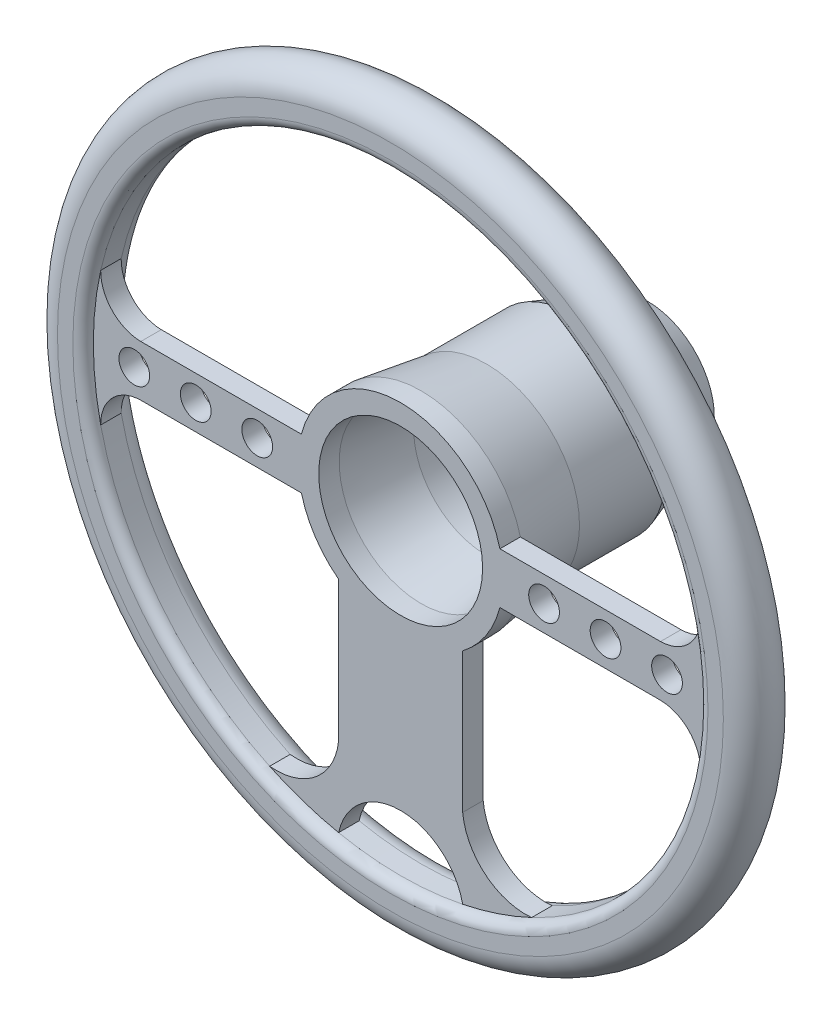
from build123d import *

# Parameters (mm, degrees)
SZKIC1_R                    = 175
SZKIC1_R_2                  = 40
SZKIC1_R_3                  = 7.5
DODANIE_WYCI_GNI_CIE1_DEPTH = 25
ZAOKR_GLENIE1_R             = 12.5
SZKIC2_W                    = 10
SZKIC2_H                    = 150
SZKIC3_W                    = 5
SZKIC3_H                    = 150
ZAOKR_GLENIE4_R             = 10
ZAOKR_GLENIE5_R             = 5
SZKIC5_R                    = 12
SZKIC5_R_2                  = 4
WYTNIJ_WYCI_GNI_CIE1_DEPTH  = 25
DODANIE_WYCI_GNI_CIE4_START = 45
SZKIC9_R                    = 27.052132897
SZKIC9_R_2                  = 12
SZKIC9_R_3                  = 4
DODANIE_WYCI_GNI_CIE4_DEPTH = 45


with BuildPart() as part:
    # Szkic1 → Dodanie-wyciągnięcie1 (new body)
    with BuildSketch(Plane.XY):
        Circle(SZKIC1_R)
        Circle(SZKIC1_R_2, mode=Mode.SUBTRACT)
        with BuildLine():
            ThreePointArc((63.948658552, -135.685552176), (41.3963046, -128.857575517), (30.277490786, -108.082544509))
            Line((30.277490786, -108.082544509), (30.277490786, -39.790370088))
            ThreePointArc((30.277490786, -39.790370088), (41.668308443, -27.636064689), (48.434312767, -12.414400782))
            Line((48.434312767, -12.414400782), (126.821344913, -12.414400782))
            ThreePointArc((126.821344913, -12.414400782), (140.806039181, -18.492039568), (146.397171731, -32.678251316))
            ThreePointArc((146.397171731, -32.678251316), (117.106652616, -93.733835476), (63.948658552, -135.685552176))
        make_face(mode=Mode.SUBTRACT)
        with BuildLine():
            ThreePointArc((146.397171731, 32.678251316), (140.806039181, 18.492039568), (126.821344913, 12.414400782))
            Line((126.821344913, 12.414400782), (48.434312767, 12.414400782))
            ThreePointArc((48.434312767, 12.414400782), (0, 50), (-48.434312767, 12.414400782))
            Line((-48.434312767, 12.414400782), (-126.821344913, 12.414400782))
            ThreePointArc((-126.821344913, 12.414400782), (-140.806039181, 18.492039568), (-146.397171731, 32.678251316))
            ThreePointArc((-146.397171731, 32.678251316), (0, 150), (146.397171731, 32.678251316))
        make_face(mode=Mode.SUBTRACT)
        with BuildLine():
            ThreePointArc((-146.397171731, -32.678251316), (-140.806039181, -18.492039568), (-126.821344913, -12.414400782))
            Line((-126.821344913, -12.414400782), (-48.434312767, -12.414400782))
            ThreePointArc((-48.434312767, -12.414400782), (-41.668308443, -27.636064689), (-30.277490786, -39.790370088))
            Line((-30.277490786, -39.790370088), (-30.277490786, -108.082544509))
            ThreePointArc((-30.277490786, -108.082544509), (-41.3963046, -128.857575517), (-63.948658552, -135.685552176))
            ThreePointArc((-63.948658552, -135.685552176), (-117.106652616, -93.733835476), (-146.397171731, -32.678251316))
        make_face(mode=Mode.SUBTRACT)
        with BuildLine():
            ThreePointArc((-30.277490786, -146.912469014), (0, -122.410388377), (30.277490786, -146.912469014))
            ThreePointArc((30.277490786, -146.912469014), (0, -150), (-30.277490786, -146.912469014))
        make_face(mode=Mode.SUBTRACT)
        with Locations((-70, 0)):
            Circle(SZKIC1_R_3, mode=Mode.SUBTRACT)
        with Locations((-100, 0)):
            Circle(SZKIC1_R_3, mode=Mode.SUBTRACT)
        with Locations((-130, 0)):
            Circle(SZKIC1_R_3, mode=Mode.SUBTRACT)
        with Locations((100, 0)):
            Circle(SZKIC1_R_3, mode=Mode.SUBTRACT)
        with Locations((70, 0)):
            Circle(SZKIC1_R_3, mode=Mode.SUBTRACT)
        with Locations((130, 0)):
            Circle(SZKIC1_R_3, mode=Mode.SUBTRACT)
    extrude(amount=DODANIE_WYCI_GNI_CIE1_DEPTH)

    # Zaokrąglenie1
    zaokr_glenie1_edges = [part.edges().sort_by_distance(p)[0] for p in [
        (-175, 0, 25),
        (-175, 0, 0),
    ]]
    fillet(zaokr_glenie1_edges, radius=ZAOKR_GLENIE1_R - 0.0001)  # a hair under: the kernel refuses the full size

    # Szkic2 → Wycięcie-obrót1 (revolve, cut)
    with BuildSketch(Plane(origin=(0, 0, 0), x_dir=(0, 0, -1), z_dir=(1, 0, 0)), mode=Mode.PRIVATE) as wyci_cie_obr_t1_sk:
        with Locations((-5, -75)):
            Rectangle(SZKIC2_W, SZKIC2_H)
    revolve(wyci_cie_obr_t1_sk.sketch.rotate(Axis((0, 0, 10), (0, 0, -1)), 77.416921492), axis=Axis((0, 0, 10), (0, 0, -1)), mode=Mode.SUBTRACT)

    # Szkic3 → Wycięcie-obrót2 (revolve, cut)
    with BuildSketch(Plane(origin=(0, 0, 0), x_dir=(0, 0, -1), z_dir=(1, 0, 0)), mode=Mode.PRIVATE) as wyci_cie_obr_t2_sk:
        with Locations((-22.5, -75)):
            Rectangle(SZKIC3_W, SZKIC3_H)
    revolve(wyci_cie_obr_t2_sk.sketch.rotate(Axis((0, 0, 20), (0, 0, 1)), 90), axis=Axis((0, 0, 20), (0, 0, 1)), mode=Mode.SUBTRACT)

    # Zaokrąglenie4
    zaokr_glenie4_edges = [part.edges().sort_by_distance(p)[0] for p in [
        (150, 0, 0),
    ]]
    fillet(zaokr_glenie4_edges, radius=ZAOKR_GLENIE4_R - 0.0001)  # a hair under: the kernel refuses the full size

    # Zaokrąglenie5
    zaokr_glenie5_edges = [part.edges().sort_by_distance(p)[0] for p in [
        (149.096572328, -16.438130069, 25),
    ]]
    fillet(zaokr_glenie5_edges, radius=ZAOKR_GLENIE5_R - 0.0001)  # a hair under: the kernel refuses the full size

    # Szkic4 → Obrót3 (revolve)
    with BuildSketch(Plane(origin=(0, 0, 0), x_dir=(0, 0, -1), z_dir=(1, 0, 0))):
        Polygon((-10, 50), (21.913455258, 45.379893009), (63.909884625, 45.379893009), (100.428518858, 32.678251316), (100.428518858, 0), (90.618518858, 0), (90.618518858, 27.052132897), (63.909884625, 35.565510059), (21.913455258, 35.565510059), (-10, 40), align=None)
    revolve(axis=Axis((0, 0, -90.618518858), (0, 0, 1)))

    # Szkic5 → Wytnij-wyciągnięcie1 (cut)
    with BuildSketch(Plane.XY.offset(-90.618518858)):
        Circle(SZKIC5_R)
        with Locations((0, 20)):
            Circle(SZKIC5_R_2)
        with Locations((20, 0)):
            Circle(SZKIC5_R_2)
        with Locations((0, -20)):
            Circle(SZKIC5_R_2)
        with Locations((-20, 0)):
            Circle(SZKIC5_R_2)
    extrude(amount=-WYTNIJ_WYCI_GNI_CIE1_DEPTH, mode=Mode.SUBTRACT)

    # Szkic9 → Dodanie-wyciągnięcie4 (add)
    with BuildSketch(Plane.XY.offset(-90.618518858).offset(DODANIE_WYCI_GNI_CIE4_START)):
        with Locations(Location((0, 0, 0), (0, 0, 180))):
            Circle(SZKIC9_R)
        Circle(SZKIC9_R_2, mode=Mode.SUBTRACT)
        with Locations((0, 20)):
            Circle(SZKIC9_R_3, mode=Mode.SUBTRACT)
        with Locations((20, 0)):
            Circle(SZKIC9_R_3, mode=Mode.SUBTRACT)
        with Locations((0, -20)):
            Circle(SZKIC9_R_3, mode=Mode.SUBTRACT)
        with Locations((-20, 0)):
            Circle(SZKIC9_R_3, mode=Mode.SUBTRACT)
    extrude(amount=-DODANIE_WYCI_GNI_CIE4_DEPTH)

    # Szkic10 → Obrót4 (revolve)
    with BuildSketch(Plane(origin=(0, 0, 0), x_dir=(0, 0, -1), z_dir=(1, 0, 0)), mode=Mode.PRIVATE) as obr_t4_sk:
        Polygon((63.909884625, 35.565510059), (45.618518858, 35.565510059), (45.618518858, 12), (57.670604535, 12), (57.670604535, 27.052132897), (90.618518858, 27.052132897), align=None)
    revolve(obr_t4_sk.sketch.rotate(Axis((0, 0, 0), (0, 0, -1)), 90), axis=Axis((0, 0, 0), (0, 0, -1)))


solid = part.part
